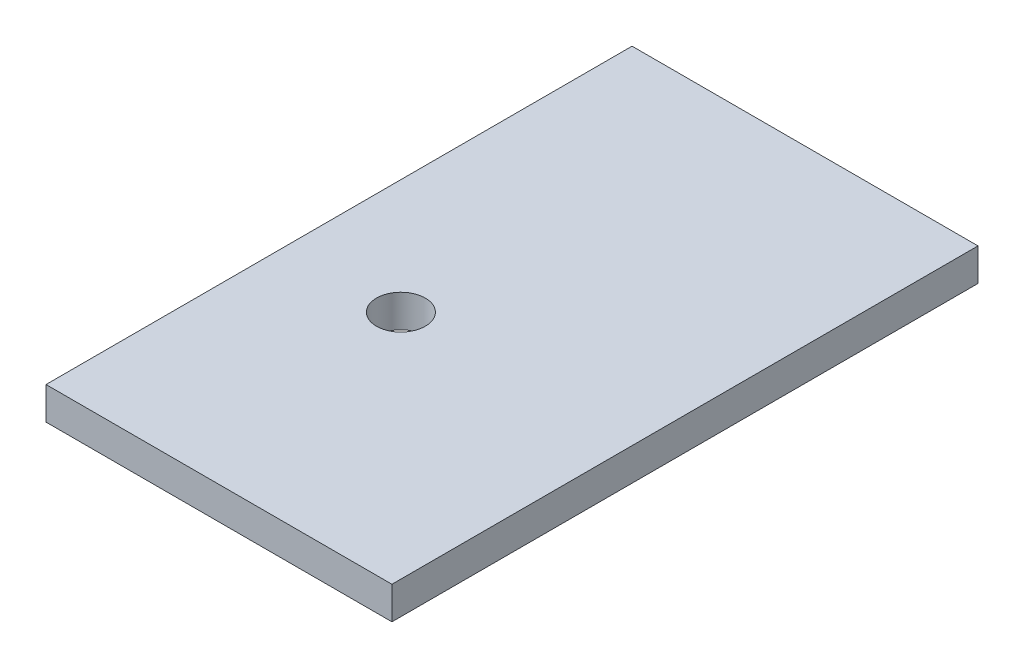
from build123d import *

# Parameters (mm, degrees)
SKETCH1_W           = 42.5
SKETCH1_H           = 72
SKETCH1_R           = 3
BOSS_EXTRUDE1_DEPTH = 4


with BuildPart() as part:
    # Sketch1 → Boss-Extrude1 (new body)
    with BuildSketch(Plane(origin=(0, 0, 0), x_dir=(1, 0, 0), z_dir=(0, 1, 0))):
        Rectangle(SKETCH1_W, SKETCH1_H)
        with Locations((-7.149568334, -6.5)):
            Circle(SKETCH1_R, mode=Mode.SUBTRACT)
    extrude(amount=BOSS_EXTRUDE1_DEPTH)


solid = part.part
